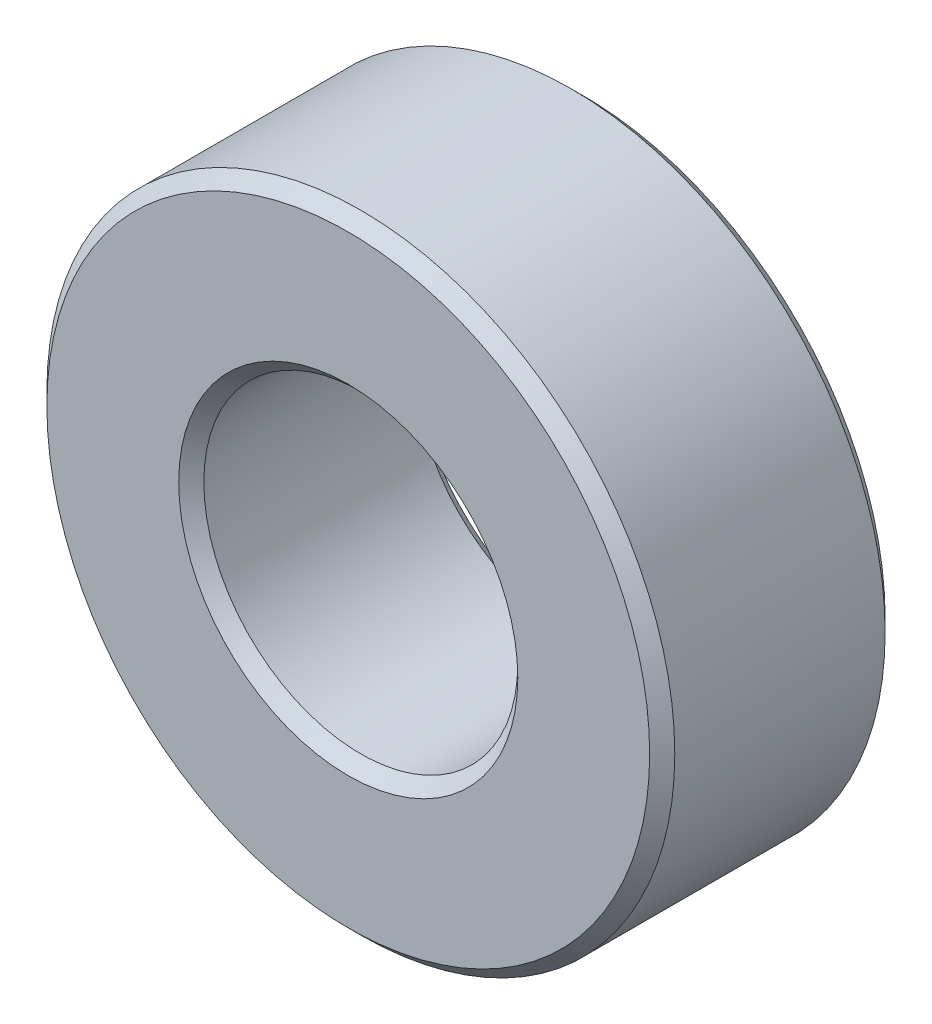
from build123d import *

# Parameters (mm, degrees)
SKETCH1_R           = 6.35
SKETCH1_R_2         = 3.175
BOSS_EXTRUDE1_DEPTH = 4.7625
CHAMFER1_SIZE       = 0.254


with BuildPart() as part:
    # Sketch1 → Boss-Extrude1 (new body)
    with BuildSketch(Plane.XY):
        Circle(SKETCH1_R)
        Circle(SKETCH1_R_2, mode=Mode.SUBTRACT)
    extrude(amount=BOSS_EXTRUDE1_DEPTH)

    # Chamfer1
    chamfer1_edges = [part.edges().sort_by_distance(p)[0] for p in [
        (-3.175, 0, 0),
        (-3.175, 0, 4.7625),
        (-6.35, 0, 0),
        (-6.35, 0, 4.7625),
    ]]
    chamfer(chamfer1_edges, length=CHAMFER1_SIZE)


solid = part.part
